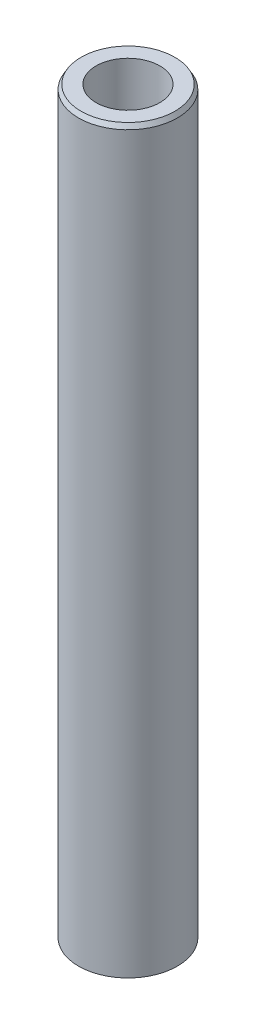
from build123d import *
from OCP.BRepFilletAPI import BRepFilletAPI_MakeChamfer

# Parameters (mm, degrees)
SKETCH1_R           = 40
BOSS_EXTRUDE1_DEPTH = 600
SKETCH2_R           = 25.795580737
CUT_EXTRUDE1_DEPTH  = 603.660766933
CHAMFER1_SIZE       = 3.63023459
CHAMFER1_SIZE2      = 2.095916918


with BuildPart() as part:
    # Sketch1 → Boss-Extrude1 (new body)
    with BuildSketch(Plane(origin=(0, 0, 0), x_dir=(1, 0, 0), z_dir=(0, 1, 0))):
        Circle(SKETCH1_R)
    extrude(amount=BOSS_EXTRUDE1_DEPTH)

    # Sketch2 → Cut-Extrude1 (cut, through all)
    with BuildSketch(Plane(origin=(0, 0, 0), x_dir=(1, 0, 0), z_dir=(0, 1, 0))):
        Circle(SKETCH2_R)
    extrude(amount=CUT_EXTRUDE1_DEPTH, mode=Mode.SUBTRACT)

    # Chamfer1: one chamfer whose edges measure the first distance from different faces: ONE call of the kernel's chamfer builder (chamfer() names one face for all edges)
    chamfer1_edges_1 = [part.edges().sort_by_distance(p)[0] for p in [
        (-40, 600, 0),
    ]]
    chamfer1_side_1 = [part.faces().sort_by_distance(p)[0] for p in [
        (-40, 300, 0),
    ]]
    chamfer1_edges_2 = [part.edges().sort_by_distance(p)[0] for p in [
        (-40, 0, 0),
    ]]
    chamfer1_side_2 = [part.faces().sort_by_distance(p)[0] for p in [
        (-38.86862915, 0, 0),
    ]]
    chamfer1 = BRepFilletAPI_MakeChamfer(part.part.solid().wrapped)
    for e in chamfer1_edges_1:
        chamfer1.Add(CHAMFER1_SIZE, CHAMFER1_SIZE2, e.wrapped, chamfer1_side_1[0].wrapped)  # the first distance lies on this face
    for e in chamfer1_edges_2:
        chamfer1.Add(CHAMFER1_SIZE, CHAMFER1_SIZE2, e.wrapped, chamfer1_side_2[0].wrapped)  # the first distance lies on this face
    add(Compound.cast(chamfer1.Shape()), mode=Mode.REPLACE)


solid = part.part
